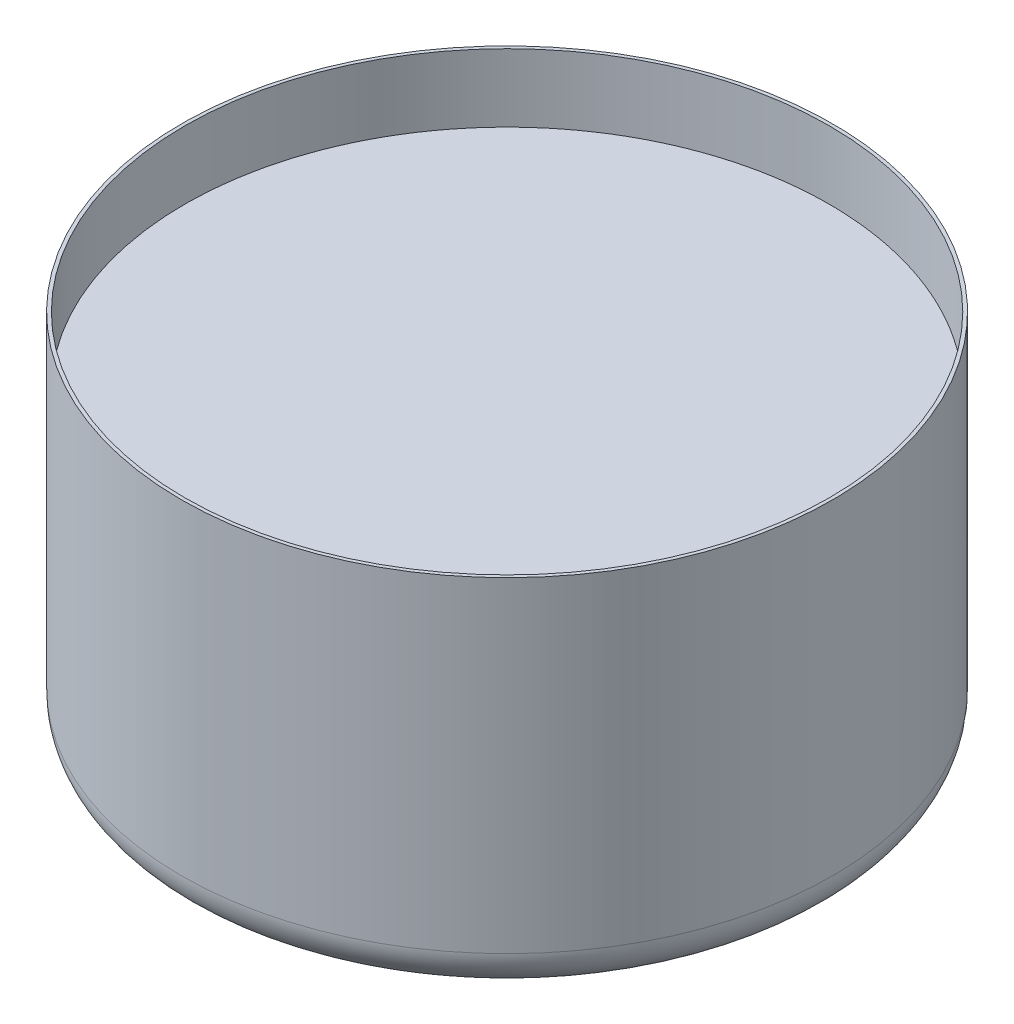
from build123d import *

# Parameters (mm, degrees)
SKETCH1_R           = 609.6
BOSS_EXTRUDE1_DEPTH = 685.8
FILLET1_R           = 76.2
SHELL1_T            = -6.35


# Read off the part's stored shape, not the designer's step: Boss-Extrude2
with BuildPart() as part:
    # Sketch1 → Boss-Extrude1 (new body)
    with BuildSketch(Plane(origin=(0, 0, 0), x_dir=(1, 0, 0), z_dir=(0, 1, 0))):
        with Locations(Location((0, 0, 0), (0, 0, 270))):
            Circle(SKETCH1_R)
    extrude(amount=BOSS_EXTRUDE1_DEPTH)

    # Fillet1
    fillet1_edges = [part.edges().sort_by_distance(p)[0] for p in [
        (0, 0, -609.6),
    ]]
    fillet(fillet1_edges, radius=FILLET1_R)

    # Shell1
    shell1_openings = [part.faces().sort_by_distance(p)[0] for p in [
        (0, 685.8, 0),
    ]]
    offset(amount=SHELL1_T, openings=shell1_openings, kind=Kind.INTERSECTION)


with BuildPart() as body_2:
    # Boss-Extrude2 outline → Boss-Extrude2 (revolve)
    with BuildSketch(Plane.XY):
        with BuildLine():
            Line((0, 558.8), (0, 6.35))
            Line((0, 6.35), (533.4, 6.35))
            ThreePointArc((533.4, 6.35), (582.791408666, 26.808591334), (603.25, 76.2))
            Line((603.25, 76.2), (603.25, 558.8))
            Line((603.25, 558.8), (0, 558.8))
        make_face()
    revolve(axis=Axis((0, 0, 0), (0, 1, 0)))


solid = Compound([part.part, body_2.part])
